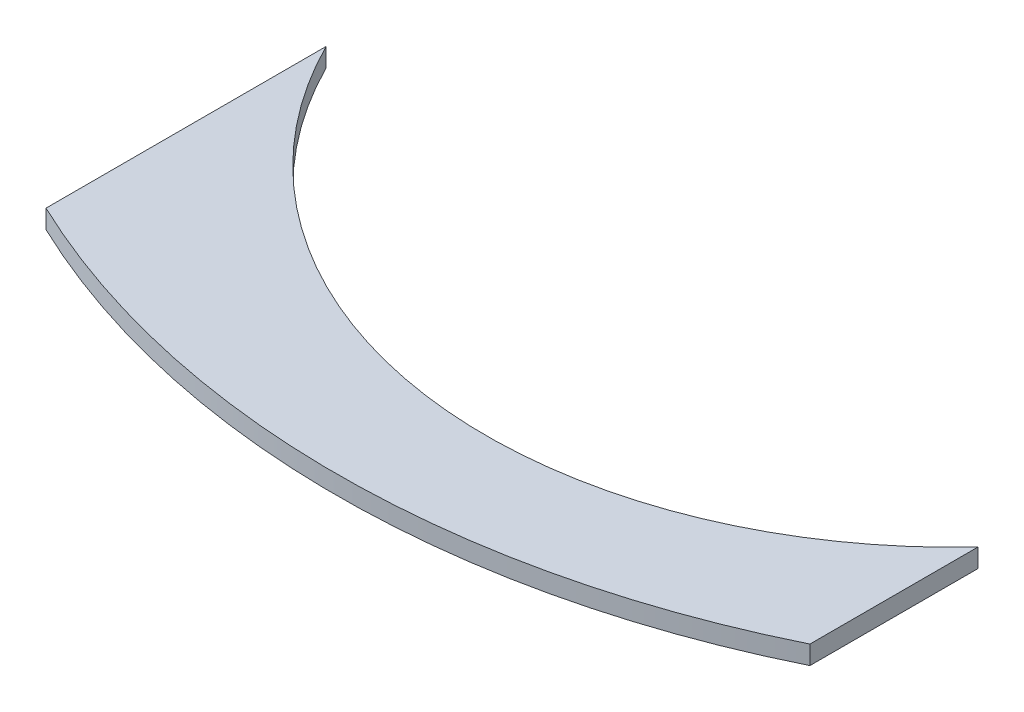
from build123d import *

# Parameters (mm, degrees)
BASE_FLANGE1_DEPTH = 3


# Sheet-metal steps are written as plain solids
with BuildPart() as part:
    # Sketch1 → Base-Flange1 (new body)
    with BuildSketch(Plane(origin=(0, 0, 0), x_dir=(1, 0, 0), z_dir=(0, 1, 0))):
        with BuildLine():
            Line((0, 22.5), (0, -22.5))
            ThreePointArc((0, -22.5), (61.081912634, -36.131160269), (122, -21.785596043))
            Line((122, -21.785596043), (122, 5.214403957))
            ThreePointArc((122, 5.214403957), (56.478690308, -18.053747525), (0, 22.5))
        make_face()
    extrude(amount=-BASE_FLANGE1_DEPTH)


solid = part.part
